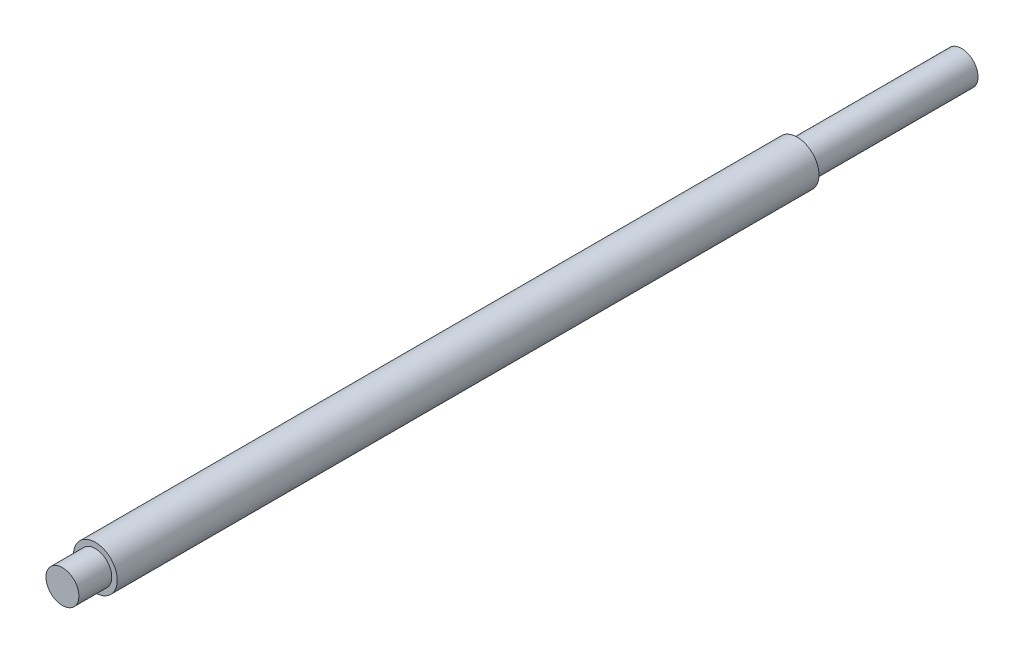
from build123d import *

# Parameters (mm, degrees)
SKETCH1_R           = 6.35
BOSS_EXTRUDE1_DEPTH = 260.35
SKETCH2_R           = 6.35
SKETCH2_R_2         = 4.7625
LONG_TRIM_DEPTH     = 47.625
CUT_EXTRUDE2_START  = -9.525
SKETCH3_R           = 6.35
SKETCH3_R_2         = 4.7625
CUT_EXTRUDE2_DEPTH  = 9.525


with BuildPart() as part:
    # Sketch1 → Boss-Extrude1 (new body)
    with BuildSketch(Plane.XY):
        Circle(SKETCH1_R)
    extrude(amount=BOSS_EXTRUDE1_DEPTH)

    # Sketch2 → long-trim (cut)
    with BuildSketch(Plane(origin=(0, 0, 0), x_dir=(-1, 0, 0), z_dir=(0, 0, -1))):
        Circle(SKETCH2_R)
        Circle(SKETCH2_R_2, mode=Mode.SUBTRACT)
    extrude(amount=-LONG_TRIM_DEPTH, mode=Mode.SUBTRACT)

    # Sketch3 → Cut-Extrude2 (cut)
    with BuildSketch(Plane.XY.offset(260.35).offset(CUT_EXTRUDE2_START)):
        Circle(SKETCH3_R)
        Circle(SKETCH3_R_2, mode=Mode.SUBTRACT)
    extrude(amount=CUT_EXTRUDE2_DEPTH, mode=Mode.SUBTRACT)


solid = part.part
